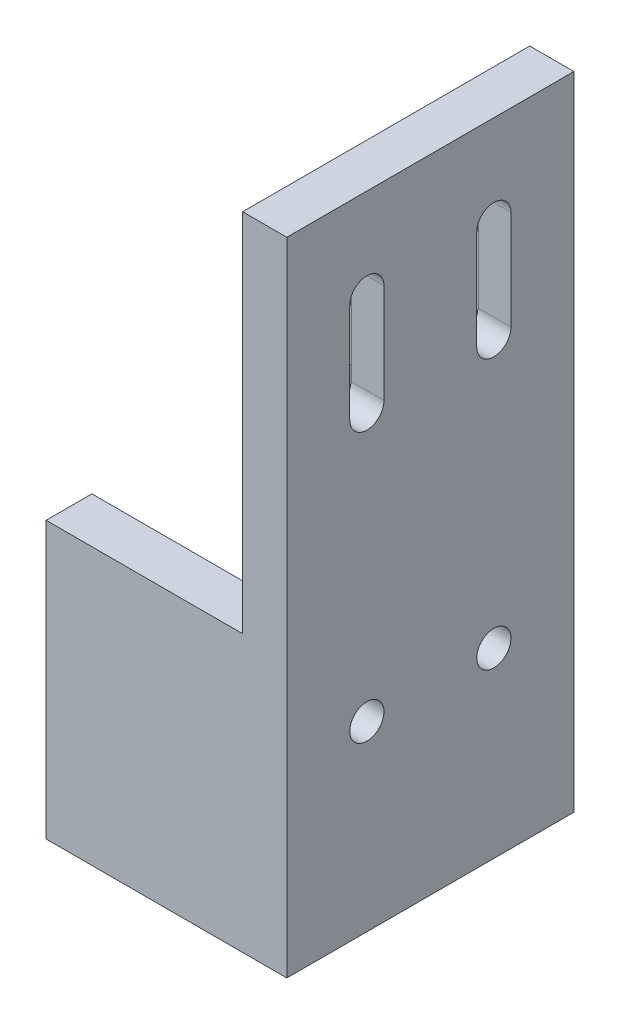
from build123d import *

# Parameters (mm, degrees)
PROFILESKETCH1_W                          = 4
PROFILESKETCH1_H                          = 58.1
BOSS_EXTRUDE1_DEPTH                       = 26
PROBESLIDINGMOUNTSKETCH4_R                = 1.55
PROBESLIDINGMOUNTCUT_EXTRUDE3_DEPTH       = 64.77781746
PROBESLIDINGMOUNTCHANELCUT_EXTRUDE4_DEPTH = 1
INDUCTIVEPROBEHOLDERSKETCH1_W             = 4.15
INDUCTIVEPROBEHOLDERSKETCH1_H             = 25
INDUCTIVEPROBEHOLDERBOSS_EXTRUDE2_DEPTH   = 17.8


with BuildPart() as part:
    # ProfileSketch1 → Boss-Extrude1 (new body)
    with BuildSketch(Plane.XY):
        with Locations((2, 29.05)):
            Rectangle(PROFILESKETCH1_W, PROFILESKETCH1_H)
    extrude(amount=BOSS_EXTRUDE1_DEPTH)

    # ProbeSlidingMountSketch4 → ProbeSlidingMountCut-Extrude3 (cut, through all)
    with BuildSketch(Plane.ZY):
        with Locations((7.25, 16.5)):
            Circle(PROBESLIDINGMOUNTSKETCH4_R)
        with Locations((18.75, 16.5)):
            Circle(PROBESLIDINGMOUNTSKETCH4_R)
        with BuildLine():
            Line((5.7, 49.9), (5.7, 40.9))
            ThreePointArc((5.7, 40.9), (7.25, 39.35), (8.8, 40.9))
            Line((8.8, 40.9), (8.8, 49.9))
            ThreePointArc((8.8, 49.9), (7.25, 51.45), (5.7, 49.9))
        make_face()
        with BuildLine():
            Line((17.2, 49.9), (17.2, 40.9))
            ThreePointArc((17.2, 40.9), (18.75, 39.35), (20.3, 40.9))
            Line((20.3, 40.9), (20.3, 49.9))
            ThreePointArc((20.3, 49.9), (18.75, 51.45), (17.2, 49.9))
        make_face()
    extrude(amount=-PROBESLIDINGMOUNTCUT_EXTRUDE3_DEPTH, mode=Mode.SUBTRACT)

    # ProbeSlidingMountChannelSketch5 → ProbeSlidingMountChanelCut-Extrude4 (cut)
    with BuildSketch(Plane.ZY):
        with BuildLine():
            Line((10.45, 49.9), (10.45, 40.9))
            ThreePointArc((10.45, 40.9), (7.25, 37.7), (4.05, 40.9))
            Line((4.05, 40.9), (4.05, 49.9))
            ThreePointArc((4.05, 49.9), (7.25, 53.1), (10.45, 49.9))
        make_face()
        with BuildLine():
            Line((21.95, 49.9), (21.95, 40.9))
            ThreePointArc((21.95, 40.9), (18.75, 37.7), (15.55, 40.9))
            Line((15.55, 40.9), (15.55, 49.9))
            ThreePointArc((15.55, 49.9), (18.75, 53.1), (21.95, 49.9))
        make_face()
    extrude(amount=-PROBESLIDINGMOUNTCHANELCUT_EXTRUDE4_DEPTH, mode=Mode.SUBTRACT)

    # InductiveProbeHolderSketch1 → InductiveProbeHolderBoss-Extrude2 (add)
    with BuildSketch(Plane.ZY):
        with Locations((2.075, 12.5)):
            Rectangle(INDUCTIVEPROBEHOLDERSKETCH1_W, INDUCTIVEPROBEHOLDERSKETCH1_H)
        with Locations((23.925, 12.5)):
            Rectangle(INDUCTIVEPROBEHOLDERSKETCH1_W, INDUCTIVEPROBEHOLDERSKETCH1_H)
    extrude(amount=INDUCTIVEPROBEHOLDERBOSS_EXTRUDE2_DEPTH)


solid = part.part
